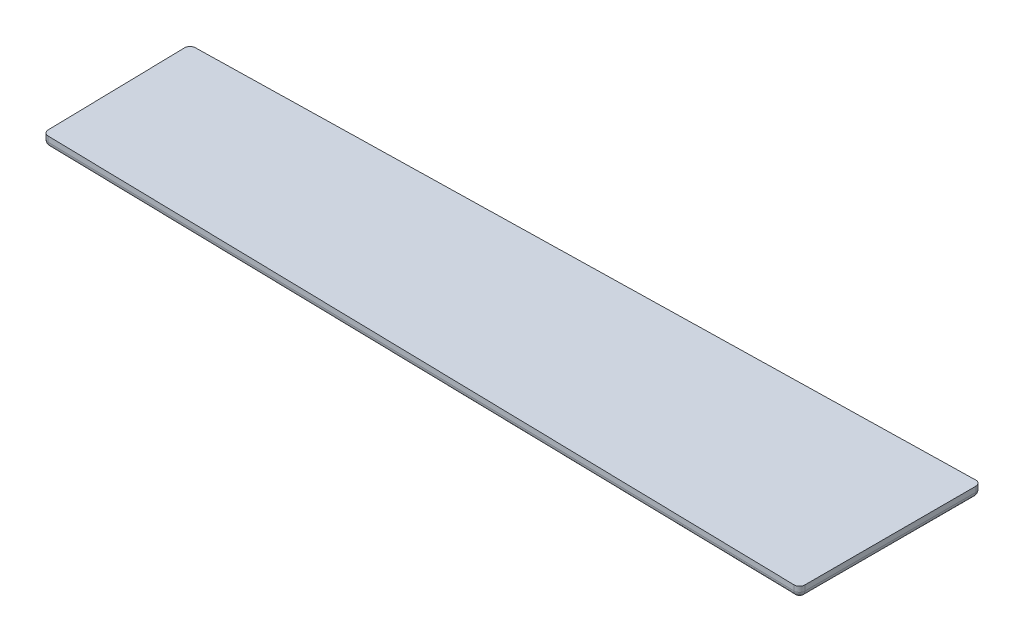
from build123d import *

# Parameters (mm, degrees)
BOSS_EXTRUDE1_DEPTH = 2.54
FILLET1_R           = 1.27
FILLET2_R           = 1.27


with BuildPart() as part:
    # Sketch1 → Boss-Extrude1 (new body)
    with BuildSketch(Plane(origin=(0, 0, 0), x_dir=(1, 0, 0), z_dir=(0, 1, 0))):
        Polygon((-92.055290994, 17.78), (-91.319094065, -17.795234922), (92.055290994, -21.59), (92.055290994, 21.59), align=None)
    extrude(amount=BOSS_EXTRUDE1_DEPTH)

    # Fillet1
    fillet1_edges = [part.edges().sort_by_distance(p)[0] for p in [
        (92.055290994, 0, 0),
        (0.368098464, 0, 19.692617461),
        (-91.68719253, 0, 0.007617461),
        (0, 0, -19.685),
    ]]
    fillet(fillet1_edges, radius=FILLET1_R)

    # Fillet2
    # the kernel refuses this fillet: 1.27 mm, written as the material it takes off along each edge
    with BuildSketch(Plane(origin=(-90.074576314, 1.27, 16.550717171), x_dir=(-0.9997859461749034, 0, 0.020689655172412804), z_dir=(0, -1, 0))) as fillet2_piece_1_section:
        Polygon((0, 0), (FILLET2_R, 0), (FILLET2_R, -FILLET2_R * 0.959450955721), (FILLET2_R * 0.0413704529452, -FILLET2_R * 0.999143876338), align=None)
    fillet2_piece_1 = extrude(amount=FILLET2_R, mode=Mode.PRIVATE)
    fillet2_piece_1 = fillet2_piece_1 - Plane(origin=(-90.074576314, 1.27, 16.550717171), x_dir=(0.7071067811865478, 0, -0.7071067811865471), z_dir=(0, -1, 0)) * Sphere(FILLET2_R, mode=Mode.PRIVATE)
    add(fillet2_piece_1, mode=Mode.SUBTRACT)
    with BuildSketch(Plane(origin=(-90.75928698, 1.27, -16.53654771), x_dir=(-0.020689655172410656, 0, -0.9997859461749034), z_dir=(-0.9997859461749034, 0, 0.020689655172412804))) as fillet2_piece_2_section:
        Polygon((0, 0), (FILLET2_R, 0), (FILLET2_R, FILLET2_R), (0, FILLET2_R), align=None)
    fillet2_piece_2 = extrude(amount=FILLET2_R, mode=Mode.PRIVATE)
    fillet2_piece_2 = fillet2_piece_2 - Plane(origin=(-90.75928698, 1.27, -16.53654771), x_dir=(0.014629795472822902, 0.7071067811865475, 0.7069554222752827), z_dir=(-0.9997859461749034, 0, 0.020689655172412804)) * Sphere(FILLET2_R, mode=Mode.PRIVATE)
    add(fillet2_piece_2, mode=Mode.SUBTRACT)
    with BuildSketch(Plane(origin=(90.785290994, 1.27, 20.293446606), x_dir=(-0.020689655172413755, 0, 0.9997859461749034), z_dir=(0, -1, 0))) as fillet2_piece_3_section:
        Polygon((0, 0), (FILLET2_R, 0), (FILLET2_R, -FILLET2_R * 1.02090818447), (-FILLET2_R * 0.0206896551724, -FILLET2_R * 0.999785946175), align=None)
    fillet2_piece_3 = extrude(amount=FILLET2_R, mode=Mode.PRIVATE)
    fillet2_piece_3 = fillet2_piece_3 - Plane(origin=(90.785290994, 1.27, 20.293446606), x_dir=(-0.6997536512329129, 0, -0.7143842296595067), z_dir=(0, -1, 0)) * Sphere(FILLET2_R, mode=Mode.PRIVATE)
    add(fillet2_piece_3, mode=Mode.SUBTRACT)
    with BuildSketch(Plane(origin=(90.785290994, 1.27, -20.293446606), x_dir=(-0.020689655172410656, 0, -0.9997859461749034), z_dir=(0, -1, 0))) as fillet2_piece_4_section:
        Polygon((0, 0), (FILLET2_R, 0), (FILLET2_R, FILLET2_R * 1.02090818447), (-FILLET2_R * 0.0206896551724, FILLET2_R * 0.999785946175), align=None)
    fillet2_piece_4 = extrude(amount=FILLET2_R, mode=Mode.PRIVATE)
    fillet2_piece_4 = fillet2_piece_4 - Plane(origin=(90.785290994, 1.27, -20.293446606), x_dir=(-0.6997536512329141, 0, 0.7143842296595057), z_dir=(0, -1, 0)) * Sphere(FILLET2_R, mode=Mode.PRIVATE)
    add(fillet2_piece_4, mode=Mode.SUBTRACT)
    with BuildSketch(Plane(origin=(92.055290994, 1.27, -21.59), x_dir=(-0.9997859461749034, 0, 0.020689655172409293), z_dir=(0, 1, 0))) as fillet2_piece_5:
        with BuildLine():
            CenterArc((FILLET2_R * 1.02090818447, FILLET2_R), FILLET2_R, 178.81448549, 91.18551451)
            Line((FILLET2_R * 0.0211222382995, FILLET2_R * 1.02068965517), (0, 0))
            Line((0, 0), (FILLET2_R * 1.02090818447, 0))
        make_face()
    extrude(amount=4.511383486, mode=Mode.SUBTRACT)
    with BuildSketch(Plane(origin=(92.055290994, 1.27, 21.59), x_dir=(-0.9997859461749034, 0, -0.020689655172415226), z_dir=(0, 1, 0))) as fillet2_piece_6:
        with BuildLine():
            CenterArc((FILLET2_R * 1.02090818447, -FILLET2_R), FILLET2_R, 90, 91.18551451)
            Line((FILLET2_R * 0.0211222382994, -FILLET2_R * 1.02068965517), (0, 0))
            Line((0, 0), (FILLET2_R * 1.02090818447, 0))
        make_face()
    extrude(amount=4.511383486, mode=Mode.SUBTRACT)
    with BuildSketch(Plane(origin=(-91.319094065, 1.27, 17.795234922), x_dir=(-0.020689655172414192, 0, -0.9997859461749034), z_dir=(0, 1, 0))) as fillet2_piece_7:
        with BuildLine():
            CenterArc((FILLET2_R * 0.959450955721, -FILLET2_R), FILLET2_R, 90, 87.62897098)
            Line((-FILLET2_R * 0.0396929206169, -FILLET2_R * 0.958629547055), (0, 0))
            Line((0, 0), (FILLET2_R * 0.959450955721, 0))
        make_face()
    extrude(amount=4.316256784, mode=Mode.SUBTRACT)
    with BuildSketch(Plane(origin=(-92.055290994, 1.27, -17.78), x_dir=(0.020689655172417935, 0, 0.9997859461749031), z_dir=(0, 1, 0))) as fillet2_piece_8:
        with BuildLine():
            CenterArc((FILLET2_R, FILLET2_R), FILLET2_R, 180, 90)
            Line((0, FILLET2_R), (0, 0))
            Line((0, 0), (FILLET2_R, 0))
        make_face()
    extrude(amount=4.445, mode=Mode.SUBTRACT)


solid = part.part
